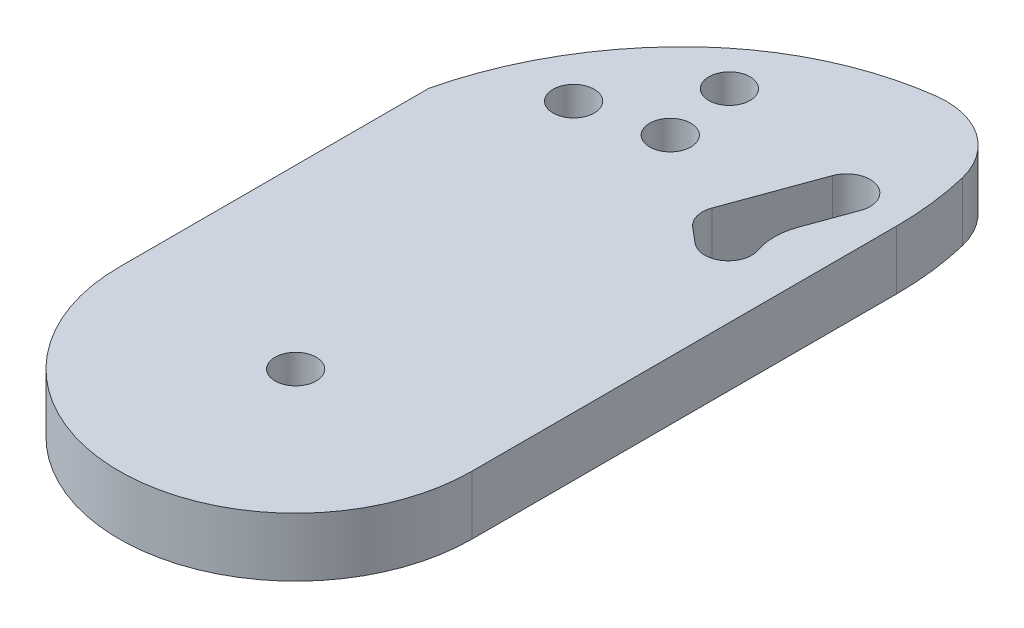
from build123d import *

# Parameters (mm, degrees)
SKETCH1_R           = 1.75
BOSS_EXTRUDE1_DEPTH = 5
FILLET1_R           = 5
CUT_EXTRUDE1_DEPTH  = 10
SKETCH3_R           = 1.75
CUT_EXTRUDE2_DEPTH  = 10


with BuildPart() as part:
    # Sketch1 → Boss-Extrude1 (new body)
    with BuildSketch(Plane(origin=(0, 0, 0), x_dir=(1, 0, 0), z_dir=(0, 1, 0))):
        with BuildLine():
            Line((-15, 50), (-15, 0))
            ThreePointArc((-15, 0), (0, -15), (15, 0))
            Line((15, 0), (15, 50))
            ThreePointArc((15, 50), (0, 65), (-15, 50))
        make_face()
        Circle(SKETCH1_R, mode=Mode.SUBTRACT)
        with BuildLine():
            ThreePointArc((8.565729634, 37.038778674), (11.129155163, 38.234123628), (12.324500118, 35.6706981))
            Line((12.324500118, 35.6706981), (10.067309136, 29.469116847))
            Line((10.067309136, 29.469116847), (10.285575219, 29.285969857))
            ThreePointArc((10.285575219, 29.285969857), (10.532088886, 26.468305752), (7.714424781, 26.221792085))
            Line((7.714424781, 26.221792085), (6.42337851, 27.305108534))
            ThreePointArc((6.42337851, 27.305108534), (5.777102077, 28.31955933), (5.829568488, 29.521237707))
            Line((5.829568488, 29.521237707), (8.565729634, 37.038778674))
        make_face(mode=Mode.SUBTRACT)
    extrude(amount=BOSS_EXTRUDE1_DEPTH)

    # Fillet1
    fillet1_edges = [part.edges().sort_by_distance(p)[0] for p in [
        (10.067309136, 2.5, -29.469116847),
    ]]
    fillet(fillet1_edges, radius=FILLET1_R)

    # Sketch2 → Cut-Extrude1 (cut)
    with BuildSketch(Plane(origin=(0, 5, 0), x_dir=(1, 0, 0), z_dir=(0, 1, 0))):
        with BuildLine():
            Line((-15, 26.324644949), (-40.925594741, 69.238213195))
            Line((-40.925594741, 69.238213195), (-58.771967888, 111.080687023))
            Line((-58.771967888, 111.080687023), (39.28439299, 102.825794629))
            Line((39.28439299, 102.825794629), (15, 36.046990739))
            ThreePointArc((15, 36.046990739), (14.81014445, 39.245839168), (14.243243524, 42.399773179))
            ThreePointArc((14.243243524, 42.399773179), (11.621838426, 46.208407589), (7.127072402, 47.292169164))
            ThreePointArc((7.127072402, 47.292169164), (-0.175202385, 45.163669538), (-6.484026655, 40.9148504))
            ThreePointArc((-6.484026655, 40.9148504), (-11.826766868, 34.252893813), (-15, 26.324644949))
        make_face()
    extrude(amount=-CUT_EXTRUDE1_DEPTH, mode=Mode.SUBTRACT)

    # Sketch3 → Cut-Extrude2 (cut)
    with BuildSketch(Plane(origin=(0, 5, 0), x_dir=(1, 0, 0), z_dir=(0, 1, 0))):
        with Locations((-1.301778952, 33.126107378)):
            Circle(SKETCH3_R)
        with Locations((-2.207127715, 39.057409395)):
            Circle(SKETCH3_R)
        with Locations((-7.905919506, 31.519764857)):
            Circle(SKETCH3_R)
    extrude(amount=-CUT_EXTRUDE2_DEPTH, mode=Mode.SUBTRACT)


solid = part.part
